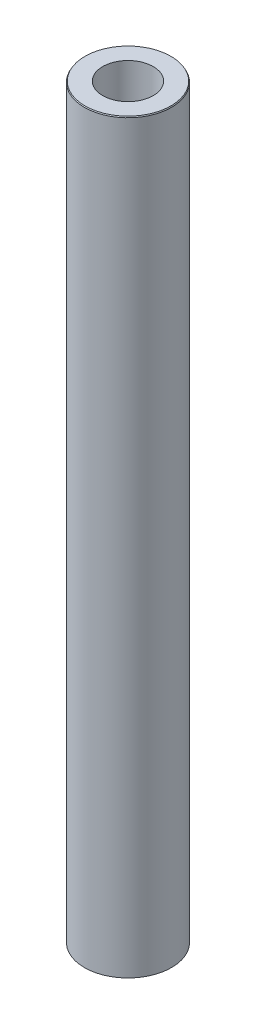
from build123d import *
from OCP.BRepFilletAPI import BRepFilletAPI_MakeChamfer

# Parameters (mm, degrees)
SKETCH1_R           = 35
BOSS_EXTRUDE1_DEPTH = 600
SKETCH2_R           = 20.274859269
CUT_EXTRUDE1_DEPTH  = 603.038204768
CHAMFER1_SIZE       = 0.802784743
CHAMFER1_SIZE2      = 0.463487988


with BuildPart() as part:
    # Sketch1 → Boss-Extrude1 (new body)
    with BuildSketch(Plane(origin=(0, 0, 0), x_dir=(1, 0, 0), z_dir=(0, 1, 0))):
        Circle(SKETCH1_R)
    extrude(amount=BOSS_EXTRUDE1_DEPTH)

    # Sketch2 → Cut-Extrude1 (cut, through all)
    with BuildSketch(Plane(origin=(0, 0, 0), x_dir=(1, 0, 0), z_dir=(0, 1, 0))):
        Circle(SKETCH2_R)
    extrude(amount=CUT_EXTRUDE1_DEPTH, mode=Mode.SUBTRACT)

    # Chamfer1: one chamfer whose edges measure the first distance from different faces: ONE call of the kernel's chamfer builder (chamfer() names one face for all edges)
    chamfer1_edges_1 = [part.edges().sort_by_distance(p)[0] for p in [
        (-35, 600, 0),
    ]]
    chamfer1_side_1 = [part.faces().sort_by_distance(p)[0] for p in [
        (-35, 300, 0),
    ]]
    chamfer1_edges_2 = [part.edges().sort_by_distance(p)[0] for p in [
        (-35, 0, 0),
    ]]
    chamfer1_side_2 = [part.faces().sort_by_distance(p)[0] for p in [
        (-34.010050506, 0, 0),
    ]]
    chamfer1 = BRepFilletAPI_MakeChamfer(part.part.solid().wrapped)
    for e in chamfer1_edges_1:
        chamfer1.Add(CHAMFER1_SIZE, CHAMFER1_SIZE2, e.wrapped, chamfer1_side_1[0].wrapped)  # the first distance lies on this face
    for e in chamfer1_edges_2:
        chamfer1.Add(CHAMFER1_SIZE, CHAMFER1_SIZE2, e.wrapped, chamfer1_side_2[0].wrapped)  # the first distance lies on this face
    add(Compound.cast(chamfer1.Shape()), mode=Mode.REPLACE)


solid = part.part
